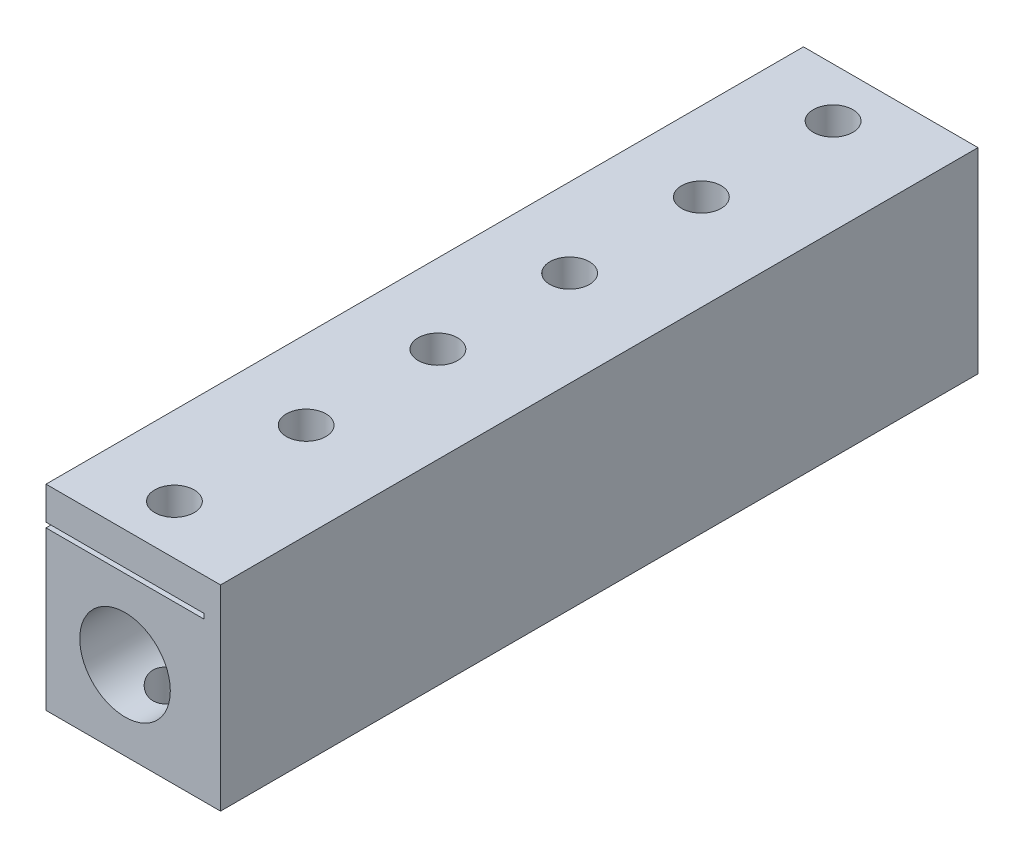
from build123d import *

# Parameters (mm, degrees)
SKETCH1_R           = 13.75
BOSS_EXTRUDE1_DEPTH = 230
CUT_EXTRUDE1_REACH  = 241.335
SKETCH3_R           = 6
SKETCH4_R           = 3.25
CUT_EXTRUDE2_DEPTH  = 240.335016243
CUT_EXTRUDE3_REACH  = 241.335
SKETCH5_R           = 6.5
CUT_EXTRUDE4_REACH  = 243.738
CUT_EXTRUDE4_START  = -5


with BuildPart() as part:
    # Sketch1 → Boss-Extrude1 (new body)
    with BuildSketch(Plane.XY):
        Polygon((-24, 24), (-24, -24), (29, -24), (29, 35.5), (-24, 35.5), (-24, 25.5), (24, 25.5), (24, 24), align=None)
        Circle(SKETCH1_R, mode=Mode.SUBTRACT)
    extrude(amount=BOSS_EXTRUDE1_DEPTH)

    # Sketch3 → Cut-Extrude1 (cut, up to next)
    with BuildSketch(Plane(origin=(0, 35.5, 0), x_dir=(1, 0, 0), z_dir=(0, 1, 0)), mode=Mode.PRIVATE) as cut_extrude1_sk1:
        with Locations((0, -15)):
            Circle(SKETCH3_R)
    cut_extrude1_tool1 = extrude(cut_extrude1_sk1.sketch, amount=-CUT_EXTRUDE1_REACH, mode=Mode.PRIVATE) & part.part
    # Sketch3 → Cut-Extrude1 (cut, up to next)
    with BuildSketch(Plane(origin=(0, 35.5, 0), x_dir=(1, 0, 0), z_dir=(0, 1, 0)), mode=Mode.PRIVATE) as cut_extrude1_sk2:
        with Locations((0, -55)):
            Circle(SKETCH3_R)
    cut_extrude1_tool2 = extrude(cut_extrude1_sk2.sketch, amount=-CUT_EXTRUDE1_REACH, mode=Mode.PRIVATE) & part.part
    # Sketch3 → Cut-Extrude1 (cut, up to next)
    with BuildSketch(Plane(origin=(0, 35.5, 0), x_dir=(1, 0, 0), z_dir=(0, 1, 0)), mode=Mode.PRIVATE) as cut_extrude1_sk3:
        with Locations((0, -95)):
            Circle(SKETCH3_R)
    cut_extrude1_tool3 = extrude(cut_extrude1_sk3.sketch, amount=-CUT_EXTRUDE1_REACH, mode=Mode.PRIVATE) & part.part
    # Sketch3 → Cut-Extrude1 (cut, up to next)
    with BuildSketch(Plane(origin=(0, 35.5, 0), x_dir=(1, 0, 0), z_dir=(0, 1, 0)), mode=Mode.PRIVATE) as cut_extrude1_sk4:
        with Locations((0, -135)):
            Circle(SKETCH3_R)
    cut_extrude1_tool4 = extrude(cut_extrude1_sk4.sketch, amount=-CUT_EXTRUDE1_REACH, mode=Mode.PRIVATE) & part.part
    # Sketch3 → Cut-Extrude1 (cut, up to next)
    with BuildSketch(Plane(origin=(0, 35.5, 0), x_dir=(1, 0, 0), z_dir=(0, 1, 0)), mode=Mode.PRIVATE) as cut_extrude1_sk5:
        with Locations((0, -175)):
            Circle(SKETCH3_R)
    cut_extrude1_tool5 = extrude(cut_extrude1_sk5.sketch, amount=-CUT_EXTRUDE1_REACH, mode=Mode.PRIVATE) & part.part
    # Sketch3 → Cut-Extrude1 (cut, up to next)
    with BuildSketch(Plane(origin=(0, 35.5, 0), x_dir=(1, 0, 0), z_dir=(0, 1, 0)), mode=Mode.PRIVATE) as cut_extrude1_sk6:
        with Locations((0, -215)):
            Circle(SKETCH3_R)
    cut_extrude1_tool6 = extrude(cut_extrude1_sk6.sketch, amount=-CUT_EXTRUDE1_REACH, mode=Mode.PRIVATE) & part.part
    add(cut_extrude1_tool1.solids().sort_by_distance((0, 35.5, 15))[0], mode=Mode.SUBTRACT)
    add(cut_extrude1_tool2.solids().sort_by_distance((0, 35.5, 55))[0], mode=Mode.SUBTRACT)
    add(cut_extrude1_tool3.solids().sort_by_distance((0, 35.5, 95))[0], mode=Mode.SUBTRACT)
    add(cut_extrude1_tool4.solids().sort_by_distance((0, 35.5, 135))[0], mode=Mode.SUBTRACT)
    add(cut_extrude1_tool5.solids().sort_by_distance((0, 35.5, 175))[0], mode=Mode.SUBTRACT)
    add(cut_extrude1_tool6.solids().sort_by_distance((0, 35.5, 215))[0], mode=Mode.SUBTRACT)

    # Sketch4 → Cut-Extrude2 (cut, through all)
    with BuildSketch(Plane(origin=(0, 35.5, 0), x_dir=(1, 0, 0), z_dir=(0, 1, 0))):
        with Locations((0, -15)):
            Circle(SKETCH4_R)
        with Locations((0, -55)):
            Circle(SKETCH4_R)
        with Locations((0, -95)):
            Circle(SKETCH4_R)
        with Locations((0, -135)):
            Circle(SKETCH4_R)
        with Locations((0, -175)):
            Circle(SKETCH4_R)
        with Locations((0, -215)):
            Circle(SKETCH4_R)
    extrude(amount=-CUT_EXTRUDE2_DEPTH, mode=Mode.SUBTRACT)

    # Sketch5 → Cut-Extrude3 (cut, up to next)
    with BuildSketch(Plane.XZ.offset(24), mode=Mode.PRIVATE) as cut_extrude3_sk1:
        with Locations((0, 215)):
            Circle(SKETCH5_R)
    cut_extrude3_tool1 = extrude(cut_extrude3_sk1.sketch, amount=-CUT_EXTRUDE3_REACH, mode=Mode.PRIVATE) & part.part
    # Sketch5 → Cut-Extrude3 (cut, up to next)
    with BuildSketch(Plane.XZ.offset(24), mode=Mode.PRIVATE) as cut_extrude3_sk2:
        with Locations((0, 175)):
            Circle(SKETCH5_R)
    cut_extrude3_tool2 = extrude(cut_extrude3_sk2.sketch, amount=-CUT_EXTRUDE3_REACH, mode=Mode.PRIVATE) & part.part
    # Sketch5 → Cut-Extrude3 (cut, up to next)
    with BuildSketch(Plane.XZ.offset(24), mode=Mode.PRIVATE) as cut_extrude3_sk3:
        with Locations((0, 135)):
            Circle(SKETCH5_R)
    cut_extrude3_tool3 = extrude(cut_extrude3_sk3.sketch, amount=-CUT_EXTRUDE3_REACH, mode=Mode.PRIVATE) & part.part
    # Sketch5 → Cut-Extrude3 (cut, up to next)
    with BuildSketch(Plane.XZ.offset(24), mode=Mode.PRIVATE) as cut_extrude3_sk4:
        with Locations((0, 95)):
            Circle(SKETCH5_R)
    cut_extrude3_tool4 = extrude(cut_extrude3_sk4.sketch, amount=-CUT_EXTRUDE3_REACH, mode=Mode.PRIVATE) & part.part
    # Sketch5 → Cut-Extrude3 (cut, up to next)
    with BuildSketch(Plane.XZ.offset(24), mode=Mode.PRIVATE) as cut_extrude3_sk5:
        with Locations((0, 55)):
            Circle(SKETCH5_R)
    cut_extrude3_tool5 = extrude(cut_extrude3_sk5.sketch, amount=-CUT_EXTRUDE3_REACH, mode=Mode.PRIVATE) & part.part
    # Sketch5 → Cut-Extrude3 (cut, up to next)
    with BuildSketch(Plane.XZ.offset(24), mode=Mode.PRIVATE) as cut_extrude3_sk6:
        with Locations((0, 15)):
            Circle(SKETCH5_R)
    cut_extrude3_tool6 = extrude(cut_extrude3_sk6.sketch, amount=-CUT_EXTRUDE3_REACH, mode=Mode.PRIVATE) & part.part
    add(cut_extrude3_tool1.solids().sort_by_distance((0, -24, 215))[0], mode=Mode.SUBTRACT)
    add(cut_extrude3_tool2.solids().sort_by_distance((0, -24, 175))[0], mode=Mode.SUBTRACT)
    add(cut_extrude3_tool3.solids().sort_by_distance((0, -24, 135))[0], mode=Mode.SUBTRACT)
    add(cut_extrude3_tool4.solids().sort_by_distance((0, -24, 95))[0], mode=Mode.SUBTRACT)
    add(cut_extrude3_tool5.solids().sort_by_distance((0, -24, 55))[0], mode=Mode.SUBTRACT)
    add(cut_extrude3_tool6.solids().sort_by_distance((0, -24, 15))[0], mode=Mode.SUBTRACT)

    # Sketch7 → Cut-Extrude4 (cut, up to next)
    with BuildSketch(Plane(origin=(0, 24, 0), x_dir=(1, 0, 0), z_dir=(0, 1, 0)).offset(CUT_EXTRUDE4_START), mode=Mode.PRIVATE) as cut_extrude4_sk1:
        Polygon((0, -8.533676985), (-5.6, -11.766838493), (-5.6, -18.233161507), (0, -21.466323015), (5.6, -18.233161507), (5.6, -11.766838493), align=None)
    cut_extrude4_tool1 = extrude(cut_extrude4_sk1.sketch, amount=-CUT_EXTRUDE4_REACH, mode=Mode.PRIVATE) & part.part
    # Sketch7 → Cut-Extrude4 (cut, up to next)
    with BuildSketch(Plane(origin=(0, 24, 0), x_dir=(1, 0, 0), z_dir=(0, 1, 0)).offset(CUT_EXTRUDE4_START), mode=Mode.PRIVATE) as cut_extrude4_sk2:
        Polygon((0, -48.533676985), (-5.6, -51.766838493), (-5.6, -58.233161507), (0, -61.466323015), (5.6, -58.233161507), (5.6, -51.766838493), align=None)
    cut_extrude4_tool2 = extrude(cut_extrude4_sk2.sketch, amount=-CUT_EXTRUDE4_REACH, mode=Mode.PRIVATE) & part.part
    # Sketch7 → Cut-Extrude4 (cut, up to next)
    with BuildSketch(Plane(origin=(0, 24, 0), x_dir=(1, 0, 0), z_dir=(0, 1, 0)).offset(CUT_EXTRUDE4_START), mode=Mode.PRIVATE) as cut_extrude4_sk3:
        Polygon((0, -88.533676985), (-5.6, -91.766838493), (-5.6, -98.233161507), (0, -101.466323015), (5.6, -98.233161507), (5.6, -91.766838493), align=None)
    cut_extrude4_tool3 = extrude(cut_extrude4_sk3.sketch, amount=-CUT_EXTRUDE4_REACH, mode=Mode.PRIVATE) & part.part
    # Sketch7 → Cut-Extrude4 (cut, up to next)
    with BuildSketch(Plane(origin=(0, 24, 0), x_dir=(1, 0, 0), z_dir=(0, 1, 0)).offset(CUT_EXTRUDE4_START), mode=Mode.PRIVATE) as cut_extrude4_sk4:
        Polygon((0, -128.533676985), (-5.6, -131.766838493), (-5.6, -138.233161507), (0, -141.466323015), (5.6, -138.233161507), (5.6, -131.766838493), align=None)
    cut_extrude4_tool4 = extrude(cut_extrude4_sk4.sketch, amount=-CUT_EXTRUDE4_REACH, mode=Mode.PRIVATE) & part.part
    # Sketch7 → Cut-Extrude4 (cut, up to next)
    with BuildSketch(Plane(origin=(0, 24, 0), x_dir=(1, 0, 0), z_dir=(0, 1, 0)).offset(CUT_EXTRUDE4_START), mode=Mode.PRIVATE) as cut_extrude4_sk5:
        Polygon((0, -168.533676985), (-5.6, -171.766838493), (-5.6, -178.233161507), (0, -181.466323015), (5.6, -178.233161507), (5.6, -171.766838493), align=None)
    cut_extrude4_tool5 = extrude(cut_extrude4_sk5.sketch, amount=-CUT_EXTRUDE4_REACH, mode=Mode.PRIVATE) & part.part
    # Sketch7 → Cut-Extrude4 (cut, up to next)
    with BuildSketch(Plane(origin=(0, 24, 0), x_dir=(1, 0, 0), z_dir=(0, 1, 0)).offset(CUT_EXTRUDE4_START), mode=Mode.PRIVATE) as cut_extrude4_sk6:
        Polygon((0, -208.533676985), (-5.6, -211.766838493), (-5.6, -218.233161507), (0, -221.466323015), (5.6, -218.233161507), (5.6, -211.766838493), align=None)
    cut_extrude4_tool6 = extrude(cut_extrude4_sk6.sketch, amount=-CUT_EXTRUDE4_REACH, mode=Mode.PRIVATE) & part.part
    add(cut_extrude4_tool1.solids().sort_by_distance((0, 19, 15))[0], mode=Mode.SUBTRACT)
    add(cut_extrude4_tool2.solids().sort_by_distance((0, 19, 55))[0], mode=Mode.SUBTRACT)
    add(cut_extrude4_tool3.solids().sort_by_distance((0, 19, 95))[0], mode=Mode.SUBTRACT)
    add(cut_extrude4_tool4.solids().sort_by_distance((0, 19, 135))[0], mode=Mode.SUBTRACT)
    add(cut_extrude4_tool5.solids().sort_by_distance((0, 19, 175))[0], mode=Mode.SUBTRACT)
    add(cut_extrude4_tool6.solids().sort_by_distance((0, 19, 215))[0], mode=Mode.SUBTRACT)


solid = part.part
